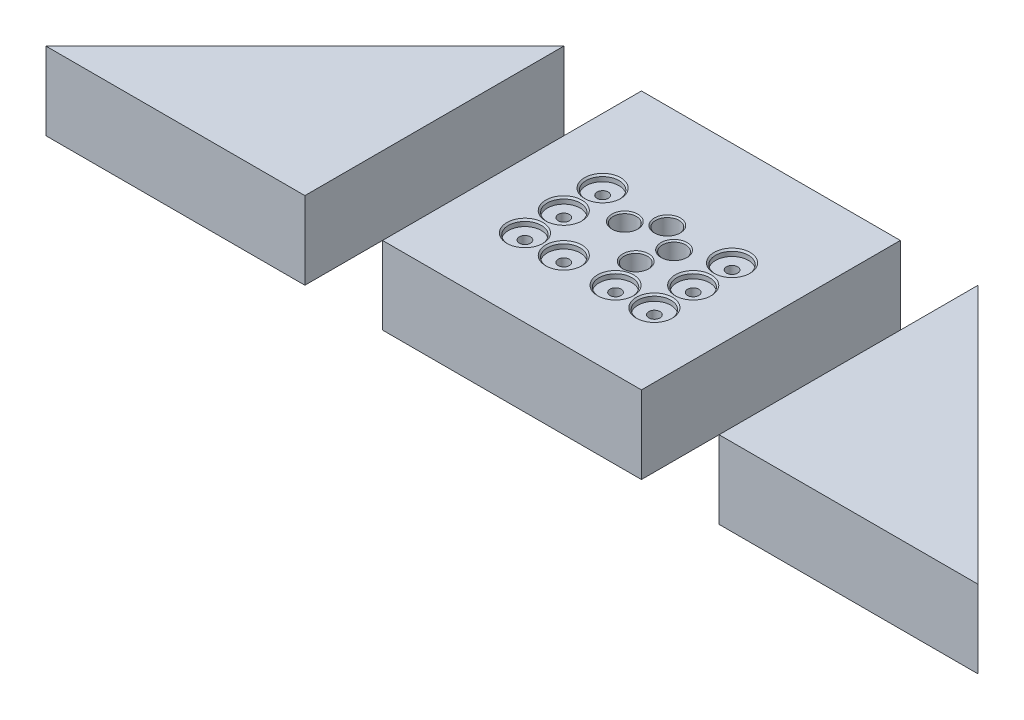
from build123d import *

# Parameters (mm, degrees)
EXTRUDE_1_DEPTH             = 30
SKETCH_2_W                  = 100
SKETCH_2_H                  = 100
EXTRUDE_1_2_DEPTH           = 30
PATTERN_LINEAR_2_COUNT      = 2
PATTERN_LINEAR_2_PITCH      = 15
PATTERN_LINEAR_2_COUNT_DIR2 = 3
PATTERN_LINEAR_2_PITCH_DIR2 = 15
PATTERN_CIRCULAR_1_COUNT    = 5


with BuildPart() as part:
    # 草图2 → 凸台-拉伸1 (new body)
    with BuildSketch(Plane(origin=(0, 0, 0), x_dir=(1, 0, 0), z_dir=(0, 1, 0))):
        Polygon((80, 50), (80, -50), (180, -50), align=None)
    extrude(amount=EXTRUDE_1_DEPTH)


with BuildPart() as body_2:
    # 草图2 → Extrude 1 2 (new body)
    with BuildSketch(Plane(origin=(0, 0, 0), x_dir=(1, 0, 0), z_dir=(0, 1, 0))):
        Rectangle(SKETCH_2_W, SKETCH_2_H)
    extrude(amount=EXTRUDE_1_2_DEPTH)

    # 草图3 → #6 六角头机械螺钉的柱形沉头孔1 (revolve, cut)
    with BuildSketch(Plane(origin=(-25, 30, -10), x_dir=(0, 0, 1), z_dir=(1, 0, 0))):
        Polygon((0, 0), (0, 30), (2.15265, 30), (2.15265, 2.3622), (6.35, 2.3622), (6.35, 0.635), (6.985, 0), align=None)
    hole_wizard_6_1 = revolve(axis=Axis((-25, 36.35, -10), (0, -1, 0)), mode=Mode.SUBTRACT)

    # 草图6 → M10x1.0 螺纹孔1 (revolve, cut)
    with BuildSketch(Plane(origin=(0, 30, -10), x_dir=(0, 0, 1), z_dir=(1, 0, 0))):
        Polygon((0, 0), (0, 30), (4.5, 30), (4.5, 0.525), (5.025, 0), align=None)
    m10x1_0_1 = revolve(axis=Axis((0, 36.35, -10), (0, -1, 0)), mode=Mode.SUBTRACT)

    # 阵列(线性)2: Hole Wizard 6 _1 2 × 3, 2 skipped
    with Locations(*[(i * PATTERN_LINEAR_2_PITCH, 0, j * PATTERN_LINEAR_2_PITCH_DIR2) for i in range(PATTERN_LINEAR_2_COUNT) for j in range(PATTERN_LINEAR_2_COUNT_DIR2) if (i, j) not in ((0, 0), (1, 0), (1, 1))]):
        add(hole_wizard_6_1, mode=Mode.SUBTRACT)

    # 阵列(圆周)1: M10x1.0 螺纹孔1 ×5 about axis, 1 skipped
    pattern_circular_1_axis = Axis((0, 0, 0), (0, 1, 0))
    add([m10x1_0_1.rotate(pattern_circular_1_axis, i * 360 / PATTERN_CIRCULAR_1_COUNT) for i in range(1, PATTERN_CIRCULAR_1_COUNT) if i not in (2,)], mode=Mode.SUBTRACT)

    # 镜向1 copy 1 sketch → 镜向1 copy 1 (revolve, cut)
    with BuildSketch(Plane(origin=(25, 30, 5), x_dir=(0, 0, 1), z_dir=(-1, 0, 0))):
        Polygon((0, 0), (0, -30), (2.15265, -30), (2.15265, -2.3622), (6.35, -2.3622), (6.35, -0.635), (6.985, 0), align=None)
    revolve(axis=Axis((25, 36.35, 5), (0, 1, 0)), mode=Mode.SUBTRACT)

    # 镜向1 copy 2 sketch → 镜向1 copy 2 (revolve, cut)
    with BuildSketch(Plane(origin=(25, 30, 20), x_dir=(0, 0, 1), z_dir=(-1, 0, 0))):
        Polygon((0, 0), (0, -30), (2.15265, -30), (2.15265, -2.3622), (6.35, -2.3622), (6.35, -0.635), (6.985, 0), align=None)
    revolve(axis=Axis((25, 36.35, 20), (0, 1, 0)), mode=Mode.SUBTRACT)

    # 镜向1 copy 3 sketch → 镜向1 copy 3 (revolve, cut)
    with BuildSketch(Plane(origin=(10, 30, 20), x_dir=(0, 0, 1), z_dir=(-1, 0, 0))):
        Polygon((0, 0), (0, -30), (2.15265, -30), (2.15265, -2.3622), (6.35, -2.3622), (6.35, -0.635), (6.985, 0), align=None)
    revolve(axis=Axis((10, 36.35, 20), (0, 1, 0)), mode=Mode.SUBTRACT)

    # 镜向1 copy 4 sketch → 镜向1 copy 4 (revolve, cut)
    with BuildSketch(Plane(origin=(25, 30, -10), x_dir=(0, 0, 1), z_dir=(-1, 0, 0))):
        Polygon((0, 0), (0, -30), (2.15265, -30), (2.15265, -2.3622), (6.35, -2.3622), (6.35, -0.635), (6.985, 0), align=None)
    revolve(axis=Axis((25, 36.35, -10), (0, 1, 0)), mode=Mode.SUBTRACT)


with BuildPart() as body_3:
    # 镜向2: mirrored copy
    add(part.part.mirror(Plane(origin=(0, 0, 0), x_dir=(0, 0, 1), z_dir=(1, 0, 0))))


solid = Compound([part.part, body_2.part, body_3.part])
